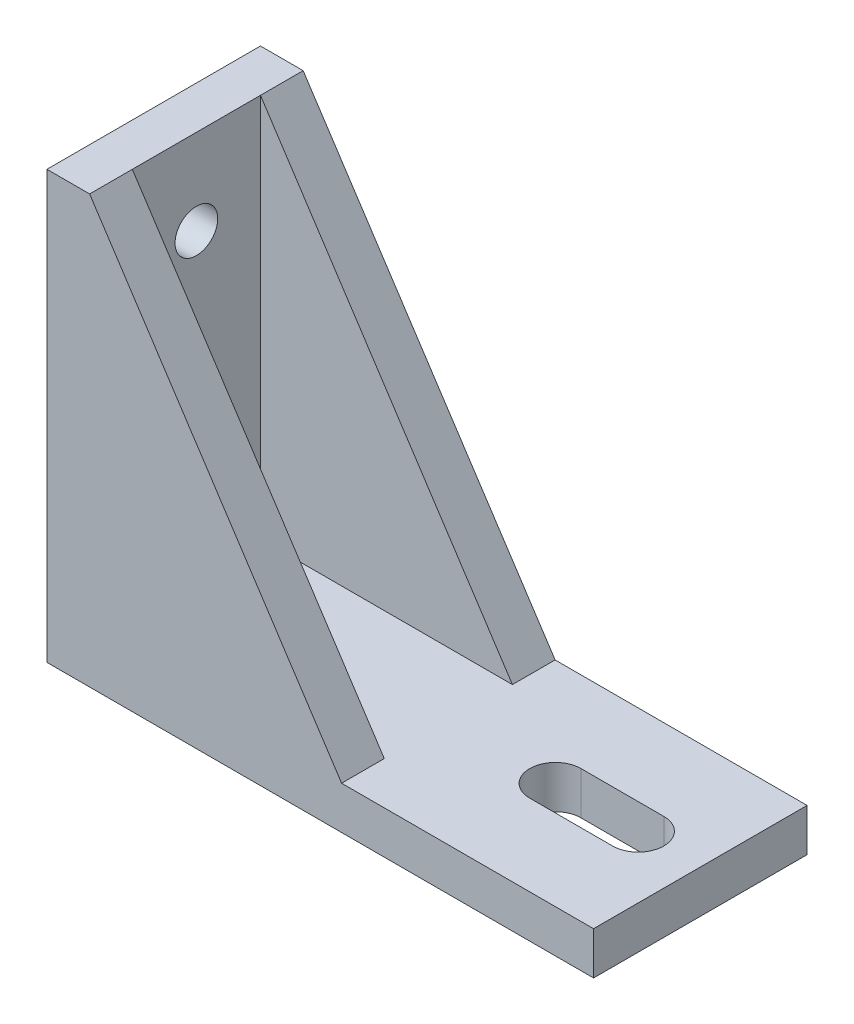
from build123d import *

# Parameters (mm, degrees)
SKETCH1_W                 = 64
SKETCH1_H                 = 15
BOSS_EXTRUDE1_DEPTH       = 5
SKETCH3_W                 = 5
SKETCH3_H                 = 15
BOSS_EXTRUDE2_DEPTH       = 45
F_5_0MM_DOWEL_HOLE1_D     = 5
F_6_0MM_DOWEL_SLOT1_DEPTH = 5
BOSS_EXTRUDE3_DEPTH       = 5
BOSS_EXTRUDE4_DEPTH       = 5


# Read off the part's stored shape, not the designer's step: Ø6.0mm Dowel Slot1
with BuildPart() as part:
    # Sketch1 → Boss-Extrude1 (new body)
    with BuildSketch(Plane(origin=(0, 0, 0), x_dir=(1, 0, 0), z_dir=(0, 1, 0))):
        with Locations((1.827783478, -3.453636176)):
            Rectangle(SKETCH1_W, SKETCH1_H)
    extrude(amount=BOSS_EXTRUDE1_DEPTH)

    # Sketch3 → Boss-Extrude2 (add)
    with BuildSketch(Plane(origin=(0, 5, 0), x_dir=(1, 0, 0), z_dir=(0, 1, 0))):
        with Locations((-27.672216522, -3.453636176)):
            Rectangle(SKETCH3_W, SKETCH3_H)
    extrude(amount=BOSS_EXTRUDE2_DEPTH)

    # Ø5.0mm Dowel Hole1 (through all)
    with Locations(Plane.ZY.offset(30.172216522)):
        with Locations((3.453636176, 15), (3.453636176, 40)):
            Hole(F_5_0MM_DOWEL_HOLE1_D / 2)

    # Ø6.0mm Dowel Slot1 outline → Ø6.0mm Dowel Slot1 (cut)
    with BuildSketch(Plane(origin=(0, 0, 0), x_dir=(1, 0, 0), z_dir=(0, 1, 0))):
        with BuildLine():
            Line((16.854220924, -6.453652479), (26.554220923, -6.453705194))
            ThreePointArc((26.554220923, -6.453705194), (29.554237227, -3.453721498), (26.554253531, -0.453705194))
            Line((26.554253531, -0.453705194), (16.854253531, -0.453652479))
            ThreePointArc((16.854253531, -0.453652479), (13.854237227, -3.453636175), (16.854220924, -6.453652479))
        make_face()
    extrude(amount=F_6_0MM_DOWEL_SLOT1_DEPTH, mode=Mode.SUBTRACT)

    # Sketch10 → Boss-Extrude3 (add)
    with BuildSketch(Plane.XY.offset(10.953636176)):
        Polygon((-25.172216522, 50), (4.327783478, 5), (33.827783478, 5), (33.827783478, 0), (-30.172216522, 0), (-30.172216522, 50), align=None)
    extrude(amount=BOSS_EXTRUDE3_DEPTH)

    # Sketch11 → Boss-Extrude4 (add)
    with BuildSketch(Plane(origin=(0, 0, -4.046363824), x_dir=(-1, 0, 0), z_dir=(0, 0, -1))):
        Polygon((25.172216522, 50), (30.172216522, 50), (30.172216522, 0), (-33.827783478, 0), (-33.827783478, 5), (-4.327783478, 5), align=None)
    extrude(amount=BOSS_EXTRUDE4_DEPTH)


solid = part.part
